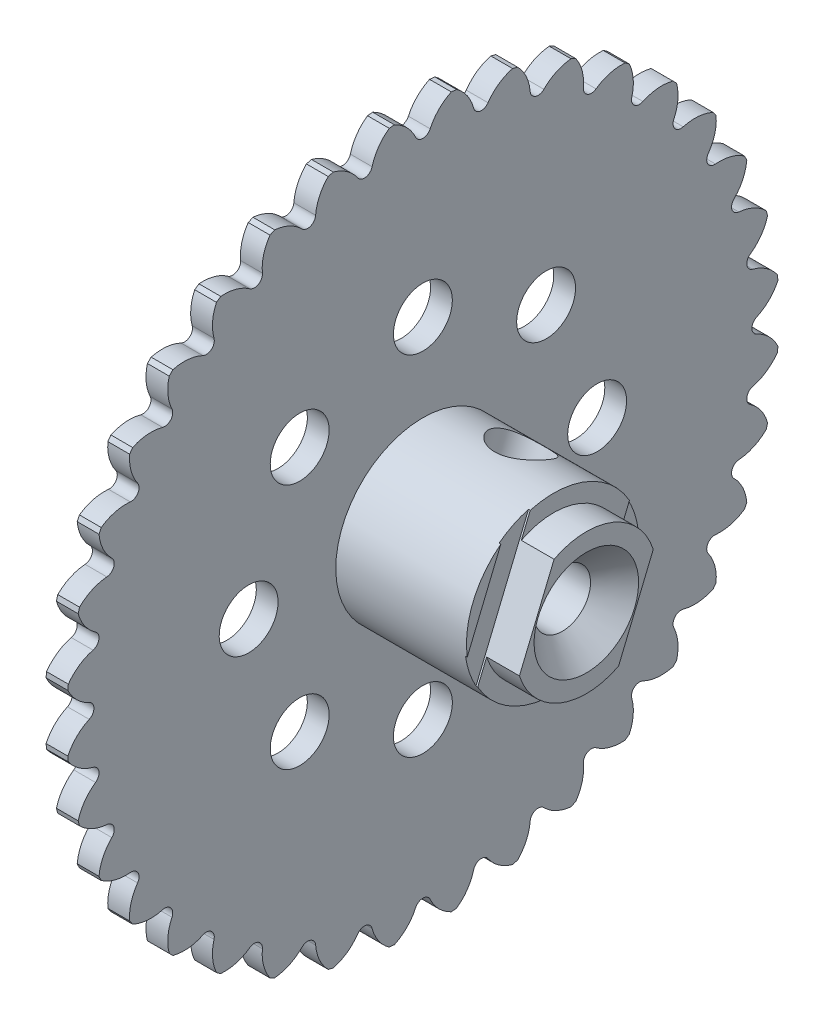
from build123d import *

# Parameters (mm, degrees)
SKETCH1_R           = 25.9588
BOSS_EXTRUDE1_DEPTH = 1.5875
SKETCH2_R           = 2.1463
CUT_EXTRUDE1_DEPTH  = 1.5875
CIRPATTERN1_COUNT   = 8
CUT_EXTRUDE2_START  = -1.5875
CUT_EXTRUDE2_DEPTH  = 1.5875
CIRPATTERN2_COUNT   = 36
SKETCH7_R           = 6.35
BOSS_EXTRUDE3_DEPTH = 9.525
BOSS_EXTRUDE4_DEPTH = 2.3876
SKETCH9_R           = 2.0574
CUT_EXTRUDE3_DEPTH  = 40.004868504
CUT_EXTRUDE4_START  = -0.127
CUT_EXTRUDE4_DEPTH  = 0.127
SKETCH12_W          = 1.984375
SKETCH12_H          = 12.7


with BuildPart() as part:
    # Sketch1 → Boss-Extrude1 (new body)
    with BuildSketch(Plane(origin=(0, 0, 0), x_dir=(0, 0, -1), z_dir=(1, 0, 0))):
        Circle(SKETCH1_R)
    extrude(amount=BOSS_EXTRUDE1_DEPTH)

    # Sketch2 → Cut-Extrude1 (cut)
    with BuildSketch(Plane(origin=(1.5875, 0, 0), x_dir=(0, 0, -1), z_dir=(1, 0, 0))):
        with Locations((0, 12.7)):
            Circle(SKETCH2_R)
    cut_extrude1 = extrude(amount=-CUT_EXTRUDE1_DEPTH, mode=Mode.SUBTRACT)

    # CirPattern1: Cut-Extrude1 ×8 about axis
    cirpattern1_axis = Axis((1.5875, 0, 0), (1, 0, 0))
    for i in range(1, CIRPATTERN1_COUNT):
        add(cut_extrude1.rotate(cirpattern1_axis, i * 360 / CIRPATTERN1_COUNT), mode=Mode.SUBTRACT)

    # Sketch4 → Cut-Extrude2 (cut)
    with BuildSketch(Plane(origin=(1.5875, 0, 0), x_dir=(0, 0, -1), z_dir=(1, 0, 0)).offset(CUT_EXTRUDE2_START)):
        with BuildLine():
            ThreePointArc((2.072622482, 25.875925751), (0, 25.9588), (-2.072622482, 25.875925751))
            ThreePointArc((-2.072622482, 25.875925751), (-1.163537989, 25.234699648), (-0.531460116, 24.319230865))
            ThreePointArc((-0.531460116, 24.319230865), (0, 23.9776), (0.531460116, 24.319230865))
            ThreePointArc((0.531460116, 24.319230865), (1.163537989, 25.234699648), (2.072622482, 25.875925751))
        make_face()
    cut_extrude2 = extrude(amount=CUT_EXTRUDE2_DEPTH, mode=Mode.SUBTRACT)

    # CirPattern2: Cut-Extrude2 ×36 about axis
    cirpattern2_axis = Axis((1.5875, 0, 0), (1, 0, 0))
    for i in range(1, CIRPATTERN2_COUNT):
        add(cut_extrude2.rotate(cirpattern2_axis, i * 360 / CIRPATTERN2_COUNT), mode=Mode.SUBTRACT)

    # Sketch7 → Boss-Extrude3 (add)
    with BuildSketch(Plane(origin=(1.5875, 0, 0), x_dir=(0, 0, -1), z_dir=(1, 0, 0))):
        Circle(SKETCH7_R)
    extrude(amount=BOSS_EXTRUDE3_DEPTH)

    # Sketch8 → Boss-Extrude4 (add)
    with BuildSketch(Plane(origin=(11.1125, 0, 0), x_dir=(0, 0, -1), z_dir=(1, 0, 0))):
        with BuildLine():
            Line((-4.876953722, -1.552504431), (-2.350740637, 4.546313459))
            ThreePointArc((-2.350740637, 4.546313459), (1.958612075, 4.728507835), (4.876953722, 1.552504431))
            Line((4.876953722, 1.552504431), (2.350740637, -4.546313459))
            ThreePointArc((2.350740637, -4.546313459), (-1.958612075, -4.728507835), (-4.876953722, -1.552504431))
        make_face()
    extrude(amount=BOSS_EXTRUDE4_DEPTH)

    # Sketch9 → Cut-Extrude3 (cut, through all)
    with BuildSketch(Plane(origin=(13.5001, 0, 0), x_dir=(0, 0, -1), z_dir=(1, 0, 0))):
        Circle(SKETCH9_R)
    extrude(amount=-CUT_EXTRUDE3_DEPTH, mode=Mode.SUBTRACT)

    # Sketch10 → Cut-Extrude4 (cut)
    with BuildSketch(Plane(origin=(11.1125, 0, 0), x_dir=(0, 0, -1), z_dir=(1, 0, 0)).offset(CUT_EXTRUDE4_START)):
        with BuildLine():
            Line((-5.528101678, -3.124514657), (-1.699592681, 6.118323685))
            ThreePointArc((-1.699592681, 6.118323685), (-2.823102406, 5.687933966), (-3.845267539, 5.053357058))
            Line((-3.845267539, 5.053357058), (-6.292277796, -0.854248291))
            ThreePointArc((-6.292277796, -0.854248291), (-6.018211534, -2.025741823), (-5.528101678, -3.124514657))
        make_face()
        with BuildLine():
            Line((3.845267539, -5.053357058), (6.292277796, 0.854248291))
            ThreePointArc((6.292277796, 0.854248291), (6.018211534, 2.025741823), (5.528101678, 3.124514657))
            Line((5.528101678, 3.124514657), (1.699592681, -6.118323685))
            ThreePointArc((1.699592681, -6.118323685), (2.823102406, -5.687933966), (3.845267539, -5.053357058))
        make_face()
    extrude(amount=CUT_EXTRUDE4_DEPTH, mode=Mode.SUBTRACT)

    # Sketch11 → Cut-Revolve4 (revolve, cut)
    with BuildSketch(Plane.XY):
        Polygon((9.6901, 0), (13.5001, 0), (13.5001, 3.81), align=None)
    revolve(axis=Axis((13.5001, 0, 0), (-1, 0, 0)), mode=Mode.SUBTRACT)

    # Sketch12 → Cut-Revolve5 (revolve, cut)
    with BuildSketch(Plane(origin=(0, 0, 0), x_dir=(-1, 0, 0), z_dir=(0, -0.3826834323650839, -0.9238795325112892))):
        with Locations((-7.3421875, 0)):
            Rectangle(SKETCH12_W, SKETCH12_H)
    revolve(axis=Axis((6.35, -5.866635031, 2.430039796), (0, 0.9238795325112892, -0.3826834323650839)), mode=Mode.SUBTRACT)


solid = part.part
